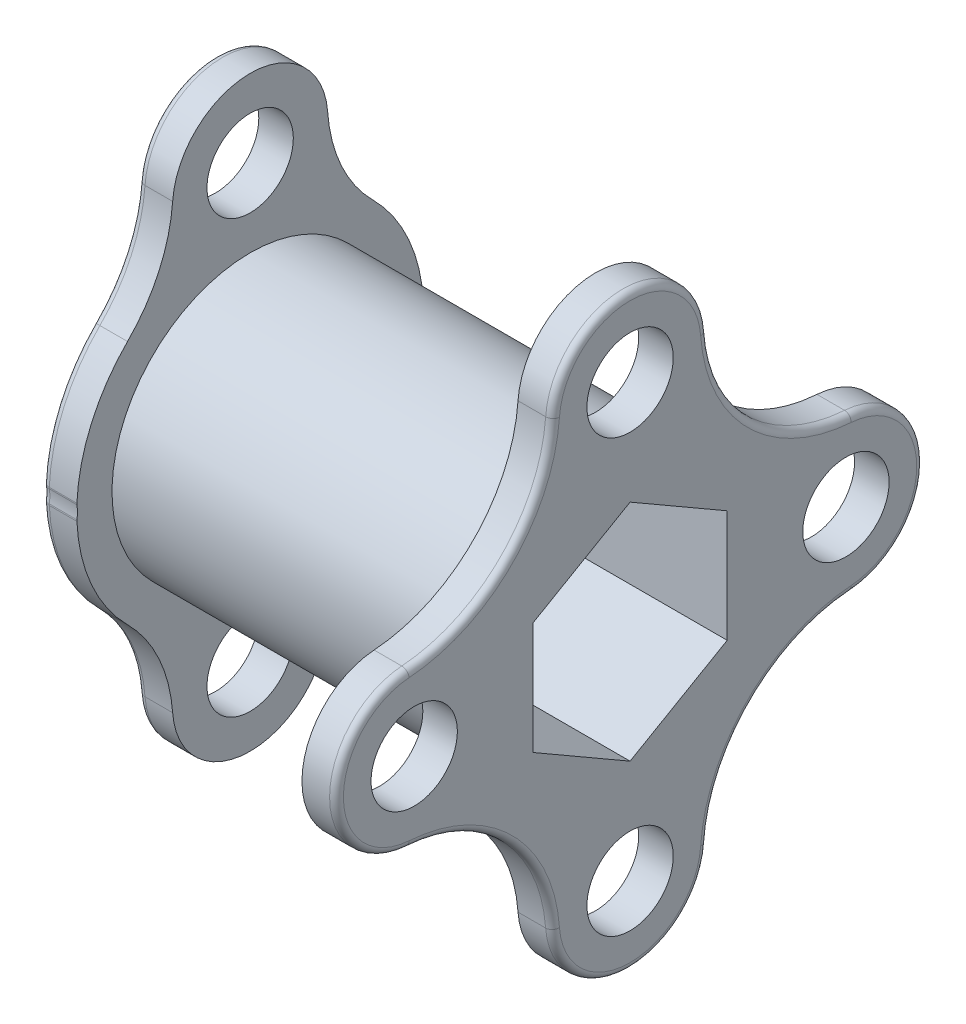
from build123d import *

# Parameters (mm, degrees)
SKETCH1_R           = 10.16
BOSS_EXTRUDE4_DEPTH = 2.54
SKETCH1_7_R         = 10.16
BOSS_EXTRUDE5_DEPTH = 25.4
BOSS_EXTRUDE7_START = -27.94
SKETCH1_9_R         = 10.16
BOSS_EXTRUDE7_DEPTH = 2.54
FILLET1_R           = 0.508
FILLET2_R           = 0.508
FILLET3_R           = 0.508


with BuildPart() as part:
    # Sketch1 → Boss-Extrude4 (new body)
    # profile 1 of 4: a face of its own
    with BuildSketch(Plane(origin=(0, 0, 0), x_dir=(0, 0, -1), z_dir=(1, 0, 0))):
        with BuildLine():
            ThreePointArc((-12.743782522, 0.525454189), (-11.680659896, 5.122721879), (-9.018871744, 9.018871744))
            ThreePointArc((-9.018871744, 9.018871744), (-12.351999156, 6.704423948), (-16.283700751, 5.700367418))
            ThreePointArc((-16.283700751, 5.700367418), (-21.59, 0), (-16.283700751, -5.700367418))
            ThreePointArc((-16.283700751, -5.700367418), (-12.351999156, -6.704423948), (-9.018871744, -9.018871744))
            ThreePointArc((-9.018871744, -9.018871744), (-11.680659896, -5.122721879), (-12.743782522, -0.525454189))
            ThreePointArc((-12.743782522, -0.525454189), (-19.05, 0), (-12.743782522, 0.525454189))
        make_face()
    # profile 2 of 4: a face of its own
    with BuildSketch(Plane(origin=(0, 0, 0), x_dir=(0, 0, -1), z_dir=(1, 0, 0))):
        with BuildLine():
            ThreePointArc((12.743782522, -0.525454189), (12.7, 0), (12.743782522, 0.525454189))
            ThreePointArc((12.743782522, 0.525454189), (11.680659896, 5.122721879), (9.018871744, 9.018871744))
            ThreePointArc((9.018871744, 9.018871744), (6.704423948, 12.351999156), (5.700367418, 16.283700751))
            ThreePointArc((5.700367418, 16.283700751), (0, 21.59), (-5.700367418, 16.283700751))
            ThreePointArc((-5.700367418, 16.283700751), (-6.704423948, 12.351999156), (-9.018871744, 9.018871744))
            ThreePointArc((-9.018871744, 9.018871744), (-11.680659896, 5.122721879), (-12.743782522, 0.525454189))
            ThreePointArc((-12.743782522, 0.525454189), (-12.710964563, 0.263637542), (-12.7, 0))
            ThreePointArc((-12.7, 0), (-12.710964563, -0.263637542), (-12.743782522, -0.525454189))
            ThreePointArc((-12.743782522, -0.525454189), (-11.680659896, -5.122721879), (-9.018871744, -9.018871744))
            ThreePointArc((-9.018871744, -9.018871744), (-6.704423948, -12.351999156), (-5.700367418, -16.283700751))
            ThreePointArc((-5.700367418, -16.283700751), (0, -21.59), (5.700367418, -16.283700751))
            ThreePointArc((5.700367418, -16.283700751), (6.704423948, -12.351999156), (9.018871744, -9.018871744))
            ThreePointArc((9.018871744, -9.018871744), (11.680659896, -5.122721879), (12.743782522, -0.525454189))
        make_face()
        with BuildLine():
            ThreePointArc((0.525454189, -12.743782522), (2.423730807, -13.82410898), (3.175, -15.875))
            ThreePointArc((3.175, -15.875), (-2.05089102, -18.298730807), (-0.525454189, -12.743782522))
            ThreePointArc((-0.525454189, -12.743782522), (0, -12.7), (0.525454189, -12.743782522))
        make_face(mode=Mode.SUBTRACT)
        Circle(SKETCH1_R, mode=Mode.SUBTRACT)
        with BuildLine():
            ThreePointArc((-0.525454189, 12.743782522), (-2.05089102, 18.298730807), (3.175, 15.875))
            ThreePointArc((3.175, 15.875), (2.423730807, 13.82410898), (0.525454189, 12.743782522))
            ThreePointArc((0.525454189, 12.743782522), (0, 12.7), (-0.525454189, 12.743782522))
        make_face(mode=Mode.SUBTRACT)
    # profile 3 of 4: a face of its own
    with BuildSketch(Plane(origin=(0, 0, 0), x_dir=(0, 0, -1), z_dir=(1, 0, 0))):
        Circle(SKETCH1_R)
        Polygon((7.14375, -4.124445986), (7.14375, 4.124445986), (0, 8.248891971), (-7.14375, 4.124445986), (-7.14375, -4.124445986), (0, -8.248891971), align=None, mode=Mode.SUBTRACT)
    # profile 4 of 4: a face of its own
    with BuildSketch(Plane(origin=(0, 0, 0), x_dir=(0, 0, -1), z_dir=(1, 0, 0))):
        with BuildLine():
            ThreePointArc((12.743782522, 0.525454189), (16.138637542, 3.164035437), (19.05, 0))
            ThreePointArc((19.05, 0), (16.138637542, -3.164035437), (12.743782522, -0.525454189))
            ThreePointArc((12.743782522, -0.525454189), (11.680659896, -5.122721879), (9.018871744, -9.018871744))
            ThreePointArc((9.018871744, -9.018871744), (12.351999156, -6.704423948), (16.283700751, -5.700367418))
            ThreePointArc((16.283700751, -5.700367418), (21.59, 0), (16.283700751, 5.700367418))
            ThreePointArc((16.283700751, 5.700367418), (12.351999156, 6.704423948), (9.018871744, 9.018871744))
            ThreePointArc((9.018871744, 9.018871744), (11.680659896, 5.122721879), (12.743782522, 0.525454189))
        make_face()
    extrude(amount=BOSS_EXTRUDE4_DEPTH)

    # Sketch1<7> → Boss-Extrude5 (add)
    with BuildSketch(Plane(origin=(0, 0, 0), x_dir=(0, 0, -1), z_dir=(1, 0, 0))):
        Circle(SKETCH1_7_R)
        Polygon((7.14375, -4.124445986), (7.14375, 4.124445986), (0, 8.248891971), (-7.14375, 4.124445986), (-7.14375, -4.124445986), (0, -8.248891971), align=None, mode=Mode.SUBTRACT)
    extrude(amount=-BOSS_EXTRUDE5_DEPTH)

    # Sketch1<9> → Boss-Extrude7 (add)
    # profile 1 of 2: a face of its own
    with BuildSketch(Plane(origin=(0, 0, 0), x_dir=(0, 0, -1), z_dir=(1, 0, 0)).offset(BOSS_EXTRUDE7_START)):
        with BuildLine():
            ThreePointArc((12.743782522, -0.525454189), (12.7, 0), (12.743782522, 0.525454189))
            ThreePointArc((12.743782522, 0.525454189), (11.680659896, 5.122721879), (9.018871744, 9.018871744))
            ThreePointArc((9.018871744, 9.018871744), (6.704423948, 12.351999156), (5.700367418, 16.283700751))
            ThreePointArc((5.700367418, 16.283700751), (0, 21.59), (-5.700367418, 16.283700751))
            ThreePointArc((-5.700367418, 16.283700751), (-6.704423948, 12.351999156), (-9.018871744, 9.018871744))
            ThreePointArc((-9.018871744, 9.018871744), (-11.680659896, 5.122721879), (-12.743782522, 0.525454189))
            ThreePointArc((-12.743782522, 0.525454189), (-12.710964563, 0.263637542), (-12.7, 0))
            ThreePointArc((-12.7, 0), (-12.710964563, -0.263637542), (-12.743782522, -0.525454189))
            ThreePointArc((-12.743782522, -0.525454189), (-11.680659896, -5.122721879), (-9.018871744, -9.018871744))
            ThreePointArc((-9.018871744, -9.018871744), (-6.704423948, -12.351999156), (-5.700367418, -16.283700751))
            ThreePointArc((-5.700367418, -16.283700751), (0, -21.59), (5.700367418, -16.283700751))
            ThreePointArc((5.700367418, -16.283700751), (6.704423948, -12.351999156), (9.018871744, -9.018871744))
            ThreePointArc((9.018871744, -9.018871744), (11.680659896, -5.122721879), (12.743782522, -0.525454189))
        make_face()
        with BuildLine():
            ThreePointArc((0.525454189, -12.743782522), (2.423730807, -13.82410898), (3.175, -15.875))
            ThreePointArc((3.175, -15.875), (-2.05089102, -18.298730807), (-0.525454189, -12.743782522))
            ThreePointArc((-0.525454189, -12.743782522), (0, -12.7), (0.525454189, -12.743782522))
        make_face(mode=Mode.SUBTRACT)
        Circle(SKETCH1_9_R, mode=Mode.SUBTRACT)
        with BuildLine():
            ThreePointArc((-0.525454189, 12.743782522), (-2.05089102, 18.298730807), (3.175, 15.875))
            ThreePointArc((3.175, 15.875), (2.423730807, 13.82410898), (0.525454189, 12.743782522))
            ThreePointArc((0.525454189, 12.743782522), (0, 12.7), (-0.525454189, 12.743782522))
        make_face(mode=Mode.SUBTRACT)
    # profile 2 of 2: a face of its own
    with BuildSketch(Plane(origin=(0, 0, 0), x_dir=(0, 0, -1), z_dir=(1, 0, 0)).offset(BOSS_EXTRUDE7_START)):
        Circle(SKETCH1_9_R)
        Polygon((7.14375, -4.124445986), (7.14375, 4.124445986), (0, 8.248891971), (-7.14375, 4.124445986), (-7.14375, -4.124445986), (0, -8.248891971), align=None, mode=Mode.SUBTRACT)
    extrude(amount=BOSS_EXTRUDE7_DEPTH)

    # Fillet1
    fillet1_edges = [part.edges().sort_by_distance(p)[0] for p in [
        (2.54, 0, -21.59),
        (2.54, 9.018871744, -9.018871744),
        (2.54, 21.59, 0),
        (2.54, 9.018871744, 9.018871744),
        (2.54, 0, 21.59),
        (2.54, -9.018871744, 9.018871744),
        (2.54, -21.59, 0),
        (2.54, -9.018871744, -9.018871744),
    ]]
    fillet(fillet1_edges, radius=FILLET1_R)

    # Fillet2
    fillet2_edges = [part.edges().sort_by_distance(p)[0] for p in [
        (-26.67, -0.525454189, 12.743782522),
        (-26.67, 0.525454189, 12.743782522),
        (-26.67, 0.525454189, -12.743782522),
        (-26.67, -0.525454189, -12.743782522),
    ]]
    fillet(fillet2_edges, radius=FILLET2_R)

    # Fillet3
    fillet3_edges = [part.edges().sort_by_distance(p)[0] for p in [
        (-27.94, 0, 12.7),
        (-27.94, -5.146734512, 11.670099354),
        (-27.94, 5.146734512, -11.670099354),
        (-27.94, 0, -12.7),
        (-27.94, 0.527966167, -12.741322921),
        (-27.94, -0.527966167, -12.741322921),
        (-27.94, 0.527966167, 12.741322921),
        (-27.94, -0.527966167, 12.741322921),
        (-27.94, 5.146734512, 11.670099354),
        (-27.94, 21.59, 0),
        (-27.94, -5.146734512, -11.670099354),
        (-27.94, -21.59, 0),
        (-27.94, 12.351999156, 6.704423948),
        (-27.94, 12.351999156, -6.704423948),
        (-27.94, -12.351999156, -6.704423948),
        (-27.94, -12.351999156, 6.704423948),
    ]]
    fillet(fillet3_edges, radius=FILLET3_R - 0.0001)  # a hair under: the kernel refuses the full size


solid = part.part
